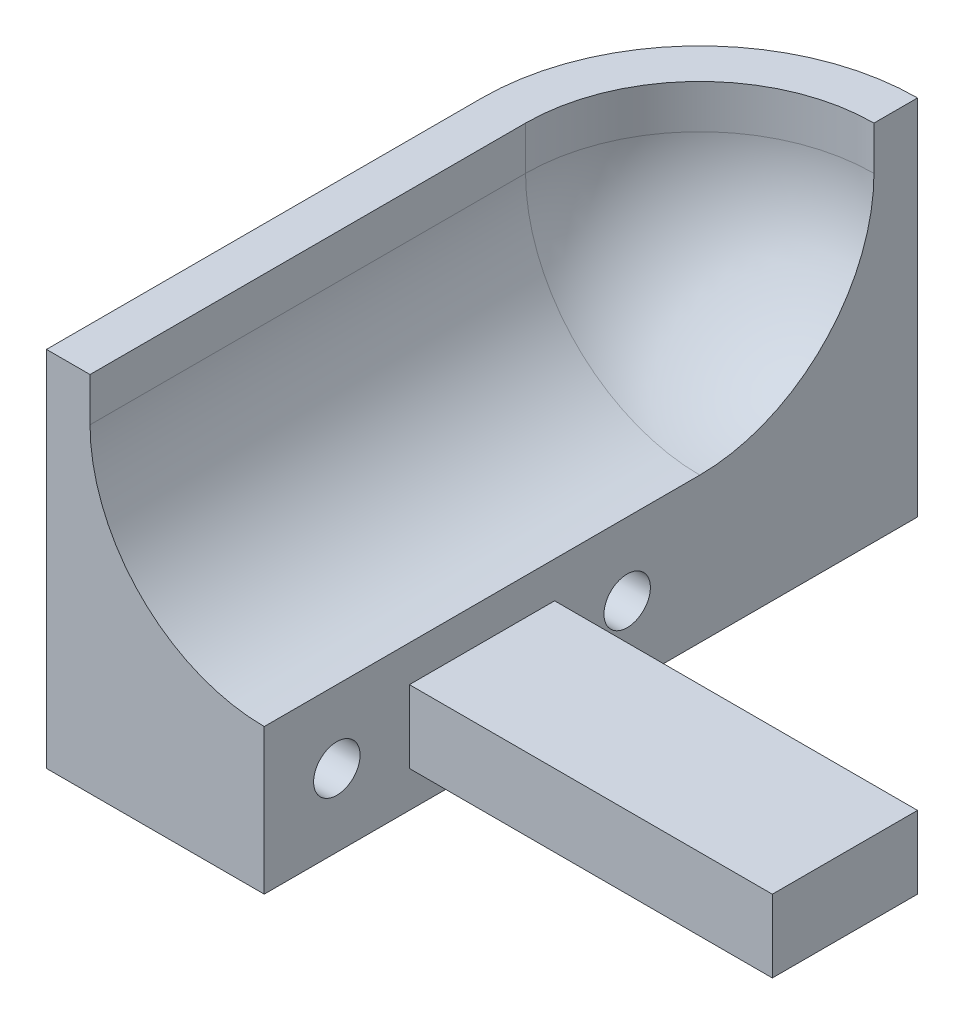
from build123d import *

# Parameters (mm, degrees)
BOSS_EXTRUDE1_DEPTH = 10
BOSS_EXTRUDE2_DEPTH = 15
SKETCH8_R           = 1.6
CUT_EXTRUDE5_DEPTH  = 60.581876439
FILLET1_R           = 12
SKETCH4_W           = 15
SKETCH4_H           = 45
CUT_EXTRUDE2_DEPTH  = 60.581876439
SKETCH6_W           = 10
SKETCH6_H           = 5
BOSS_EXTRUDE3_DEPTH = 25
CUT_EXTRUDE6_DEPTH  = 4


with BuildPart() as part:
    # Sketch1 → Boss-Extrude1 (new body)
    with BuildSketch(Plane(origin=(0, 0, 0), x_dir=(1, 0, 0), z_dir=(0, 1, 0))):
        with BuildLine():
            Line((0, 0), (30, 0))
            Line((30, 0), (30, 30))
            ThreePointArc((30, 30), (15, 45), (0, 30))
            Line((0, 30), (0, 0))
        make_face()
    extrude(amount=BOSS_EXTRUDE1_DEPTH)

    # Sketch2 → Boss-Extrude2 (add)
    with BuildSketch(Plane(origin=(0, 10, 0), x_dir=(1, 0, 0), z_dir=(0, 1, 0))):
        with BuildLine():
            Line((3, 30), (3, 3))
            Line((3, 3), (3, 0))
            Line((3, 0), (0, 0))
            Line((0, 0), (0, 30))
            ThreePointArc((0, 30), (15, 45), (30, 30))
            Line((30, 30), (30, 0))
            Line((30, 0), (27, 0))
            Line((27, 0), (27, 3))
            Line((27, 3), (27, 30))
            ThreePointArc((27, 30), (15, 42), (3, 30))
        make_face()
    extrude(amount=BOSS_EXTRUDE2_DEPTH)

    # Sketch8 → Cut-Extrude5 (cut, through all)
    with BuildSketch(Plane(origin=(0, 0, 0), x_dir=(0, 0, -1), z_dir=(1, 0, 0))):
        with Locations((5, 5)):
            Circle(SKETCH8_R)
        with Locations((25, 5)):
            Circle(SKETCH8_R)
    extrude(amount=CUT_EXTRUDE5_DEPTH, mode=Mode.SUBTRACT)

    # Fillet1
    fillet1_edges = [part.edges().sort_by_distance(p)[0] for p in [
        (3, 10, -15),
        (27, 10, -15),
        (15, 10, -42),
    ]]
    fillet(fillet1_edges, radius=FILLET1_R - 0.0001)  # a hair under: the kernel refuses the full size

    # Sketch4 → Cut-Extrude2 (cut, through all)
    with BuildSketch(Plane(origin=(0, 25, 0), x_dir=(1, 0, 0), z_dir=(0, 1, 0))):
        with Locations((22.5, 22.5)):
            Rectangle(SKETCH4_W, SKETCH4_H)
    extrude(amount=-CUT_EXTRUDE2_DEPTH, mode=Mode.SUBTRACT)

    # Sketch6 → Boss-Extrude3 (add)
    with BuildSketch(Plane(origin=(15, 0, 0), x_dir=(0, 0, -1), z_dir=(1, 0, 0))):
        with Locations((15, 5)):
            Rectangle(SKETCH6_W, SKETCH6_H)
    extrude(amount=BOSS_EXTRUDE3_DEPTH)

    # Sketch9 → Cut-Extrude6 (cut)
    with BuildSketch(Plane.ZY):
        Polygon((-8, 5), (-6.5, 7.598076211), (-3.5, 7.598076211), (-2, 5), (-3.5, 2.401923789), (-6.5, 2.401923789), align=None)
    cut_extrude6 = extrude(amount=-CUT_EXTRUDE6_DEPTH, mode=Mode.SUBTRACT)

    # Mirror2: Cut-Extrude6 across plane
    add(cut_extrude6.mirror(Plane.XY.offset(-15)), mode=Mode.SUBTRACT)


solid = part.part
